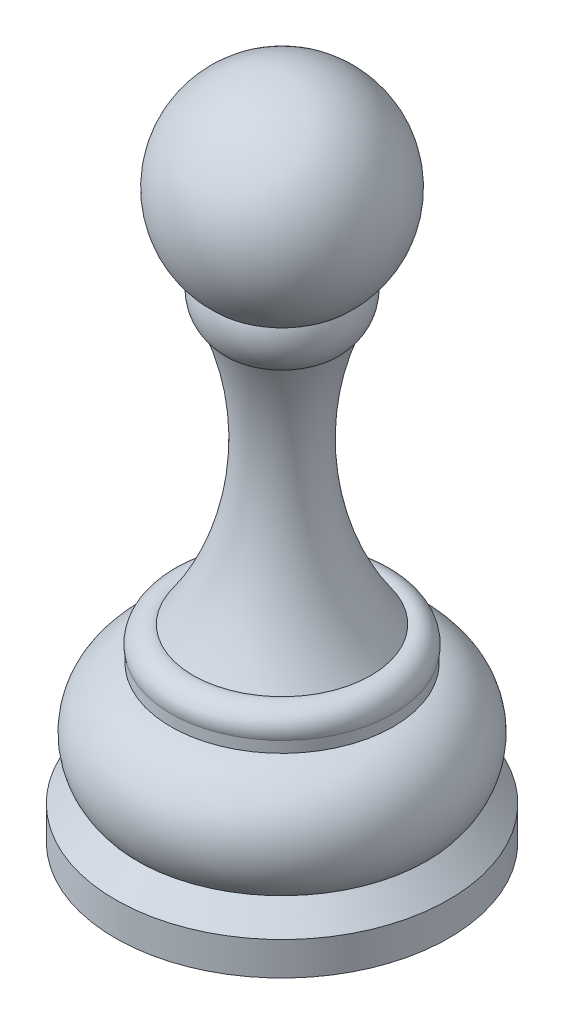
from build123d import *


with BuildPart() as part:
    # Sketch7 → Revolve1 (revolve)
    with BuildSketch(Plane.XY):
        with BuildLine():
            Line((0, 29.451264875), (0, -30.548735125))
            Line((0, -30.548735125), (15, -30.548735125))
            Line((15, -30.548735125), (15, -27.548735125))
            Line((15, -27.548735125), (13, -25.548735125))
            ThreePointArc((13, -25.548735125), (13.971755652, -20.237060994), (10, -16.578735125))
            Line((10, -16.578735125), (10, -15.578735125))
            ThreePointArc((10, -15.578735125), (9.587446141, -13.991288984), (8, -13.578735125))
            ThreePointArc((8, -13.578735125), (3.586945306, -2.292557977), (5, 9.743060943))
            ThreePointArc((5, 9.743060943), (6.055089053, 11.604288679), (6, 13.743060943))
            ThreePointArc((6, 13.743060943), (8.407551231, 23.662663683), (0, 29.451264875))
        make_face()
    revolve(axis=Axis((0, 29.451264875, 0), (0, -1, 0)))


solid = part.part
